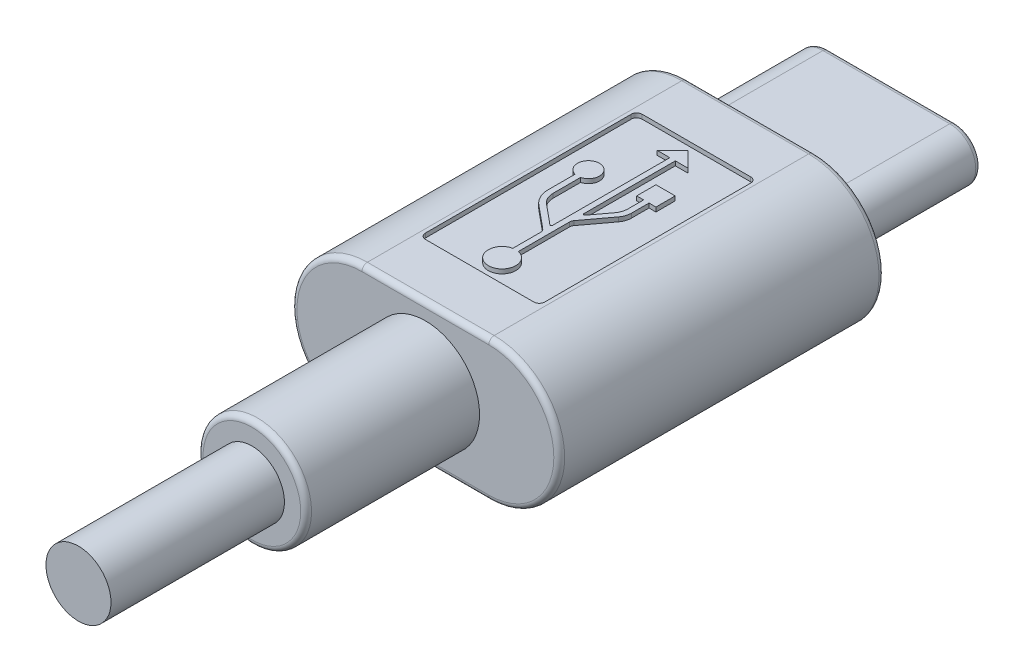
from build123d import *

# Parameters (mm, degrees)
EXTRUDE_1_DEPTH     = 15
EXTRUDE_2_DEPTH     = 6.51
CUT_EXTRUDE_1_DEPTH = 4.65
CHAMFER_1_SIZE      = 0.1
FILLET_1_R          = 0.25
CUT_EXTRUDE_2_DEPTH = 0.2
SKETCH_5_R          = 2.5
EXTRUDE_3_DEPTH     = 8
FILLET_2_R          = 0.25
SKETCH_6_R          = 1.5
EXTRUDE_4_DEPTH     = 8


with BuildPart() as part:
    # Эскиз1 → Бобышка-Вытянуть1 (new body)
    with BuildSketch(Plane.XY):
        with BuildLine():
            Line((-2.925, 3.25), (2.925, 3.25))
            ThreePointArc((2.925, 3.25), (6.175, 0), (2.925, -3.25))
            Line((2.925, -3.25), (-2.925, -3.25))
            ThreePointArc((-2.925, -3.25), (-6.175, 0), (-2.925, 3.25))
        make_face()
    extrude(amount=EXTRUDE_1_DEPTH)

    # Эскиз2 → Бобышка-Вытянуть2 (add)
    with BuildSketch(Plane(origin=(0, 0, 0), x_dir=(-1, 0, 0), z_dir=(0, 0, -1))):
        with BuildLine():
            Line((-2.925, 1.2), (2.925, 1.2))
            ThreePointArc((2.925, 1.2), (4.125, 0), (2.925, -1.2))
            Line((2.925, -1.2), (-2.925, -1.2))
            ThreePointArc((-2.925, -1.2), (-4.125, 0), (-2.925, 1.2))
        make_face()
    extrude(amount=EXTRUDE_2_DEPTH)

    # Эскиз3 → Вырез-Вытянуть1 (cut)
    with BuildSketch(Plane(origin=(0, 0, -6.51), x_dir=(-1, 0, 0), z_dir=(0, 0, -1))):
        with BuildLine():
            Line((-2.944601233, -0.65), (2.944601233, -0.65))
            ThreePointArc((2.944601233, -0.65), (3.214554933, -0.579192028), (3.415, -0.385))
            Line((3.415, -0.385), (3.415, 0.385))
            ThreePointArc((3.415, 0.385), (3.214554933, 0.579192028), (2.944601233, 0.65))
            Line((2.944601233, 0.65), (-2.944601233, 0.65))
            ThreePointArc((-2.944601233, 0.65), (-3.214554933, 0.579192028), (-3.415, 0.385))
            Line((-3.415, 0.385), (-3.415, -0.385))
            ThreePointArc((-3.415, -0.385), (-3.214554933, -0.579192028), (-2.944601233, -0.65))
        make_face()
    extrude(amount=-CUT_EXTRUDE_1_DEPTH, mode=Mode.SUBTRACT)

    # Фаска1
    chamfer_1_edges = [part.edges().sort_by_distance(p)[0] for p in [
        (3.214554933, -0.579192028, -6.51),
        (-3.214554933, -0.579192028, -6.51),
        (0, -0.65, -6.51),
    ]]
    chamfer(chamfer_1_edges, length=CHAMFER_1_SIZE)
    chamfer_1_2_edges = [part.edges().sort_by_distance(p)[0] for p in [
        (3.214554933, 0.579192028, -6.51),
        (0, 0.65, -6.51),
        (-3.214554933, 0.579192028, -6.51),
    ]]
    chamfer(chamfer_1_2_edges, length=CHAMFER_1_SIZE)
    chamfer_1_3_edges = [part.edges().sort_by_distance(p)[0] for p in [
        (-3.415, 0, -6.51),
    ]]
    chamfer(chamfer_1_3_edges, length=CHAMFER_1_SIZE - 0.0001)  # a hair under: the kernel refuses the full size
    chamfer_1_4_edges = [part.edges().sort_by_distance(p)[0] for p in [
        (3.415, 0, -6.51),
    ]]
    chamfer(chamfer_1_4_edges, length=CHAMFER_1_SIZE)

    # Скругление1
    fillet_1_edges = [part.edges().sort_by_distance(p)[0] for p in [
        (4.125, 0, -6.51),
        (0, -1.2, -6.51),
        (-4.125, 0, -6.51),
        (0, 1.2, -6.51),
    ]]
    fillet(fillet_1_edges, radius=FILLET_1_R)

    # Эскиз4 → Вырез-Вытянуть2 (cut)
    with BuildSketch(Plane(origin=(0, 3.25, 0), x_dir=(1, 0, 0), z_dir=(0, 1, 0))):
        with BuildLine():
            Line((-2.5, -2.5), (2.5, -2.5))
            ThreePointArc((2.5, -2.5), (2.679605122, -2.574394878), (2.754, -2.754))
            Line((2.754, -2.754), (2.754, -12.246))
            ThreePointArc((2.754, -12.246), (2.679605122, -12.425605122), (2.5, -12.5))
            Line((2.5, -12.5), (-2.5, -12.5))
            ThreePointArc((-2.5, -12.5), (-2.679605122, -12.425605122), (-2.754, -12.246))
            Line((-2.754, -12.246), (-2.754, -2.754))
            ThreePointArc((-2.754, -2.754), (-2.679605122, -2.574394878), (-2.5, -2.5))
        make_face()
        with BuildLine():
            Line((0, -2.878550244), (-0.716956191, -3.598432054))
            Line((-0.716956191, -3.598432054), (-0.127, -3.598432054))
            Line((-0.127, -3.598432054), (-0.127, -9.006251958))
            ThreePointArc((-0.127, -9.006251958), (-0.156162493, -9.052213445), (-0.21016765, -9.045405185))
            Line((-0.21016765, -9.045405185), (-1.120514747, -8.292828766))
            ThreePointArc((-1.120514747, -8.292828766), (-1.324422308, -8.030092949), (-1.397, -7.705530349))
            Line((-1.397, -7.705530349), (-1.397, -6.445060748))
            ThreePointArc((-1.397, -6.445060748), (-1.524, -5.445191863), (-1.651, -6.445060748))
            Line((-1.651, -6.445060748), (-1.651, -7.68561956))
            ThreePointArc((-1.651, -7.68561956), (-1.550201428, -8.136384053), (-1.267007097, -8.501281232))
            Line((-1.267007097, -8.501281232), (-0.219161751, -9.367526318))
            ThreePointArc((-0.219161751, -9.367526318), (-0.151192564, -9.455104923), (-0.127, -9.563292457))
            Line((-0.127, -9.563292457), (-0.127, -10.838615444))
            ThreePointArc((-0.127, -10.838615444), (0, -12.095785839), (0.127, -10.838615444))
            Line((0.127, -10.838615444), (0.127, -8.47461517))
            ThreePointArc((0.127, -8.47461517), (0.139930568, -8.394605616), (0.177405738, -8.322742274))
            Line((0.177405738, -8.322742274), (1.053118903, -7.148798926))
            ThreePointArc((1.053118903, -7.148798926), (1.165544414, -6.933208901), (1.204336117, -6.693180239))
            Line((1.204336117, -6.693180239), (1.204336117, -5.889691863))
            Line((1.204336117, -5.889691863), (1.524, -5.889691863))
            Line((1.524, -5.889691863), (1.524, -5.000691863))
            Line((1.524, -5.000691863), (0.635, -5.000691863))
            Line((0.635, -5.000691863), (0.635, -5.889691863))
            Line((0.635, -5.889691863), (0.954663883, -5.889691863))
            Line((0.954663883, -5.889691863), (0.954663883, -6.609767291))
            ThreePointArc((0.954663883, -6.609767291), (0.915872181, -6.849795953), (0.80344667, -7.065385978))
            Line((0.80344667, -7.065385978), (0.218518852, -7.849515015))
            ThreePointArc((0.218518852, -7.849515015), (0.161798089, -7.867354322), (0.127, -7.819140435))
            Line((0.127, -7.819140435), (0.127, -3.598432054))
            Line((0.127, -3.598432054), (0.716956191, -3.598432054))
            Line((0.716956191, -3.598432054), (0, -2.878550244))
        make_face(mode=Mode.SUBTRACT)
    extrude(amount=-CUT_EXTRUDE_2_DEPTH, mode=Mode.SUBTRACT)

    # Эскиз5 → Бобышка-Вытянуть3 (add)
    with BuildSketch(Plane.XY.offset(15)):
        Circle(SKETCH_5_R)
    extrude(amount=EXTRUDE_3_DEPTH)

    # Скругление2
    fillet_2_edges = [part.edges().sort_by_distance(p)[0] for p in [
        (6.175, 0, 15),
        (0, 3.25, 15),
        (-2.5, 0, 23),
        (-6.175, 0, 15),
        (0, 3.25, 0),
        (6.175, 0, 0),
        (0, -3.25, 0),
        (-6.175, 0, 0),
        (0, -3.25, 15),
    ]]
    fillet(fillet_2_edges, radius=FILLET_2_R)

    # Эскиз6 → Бобышка-Вытянуть4 (add)
    with BuildSketch(Plane.XY.offset(23)):
        Circle(SKETCH_6_R)
    extrude(amount=EXTRUDE_4_DEPTH)


solid = part.part
